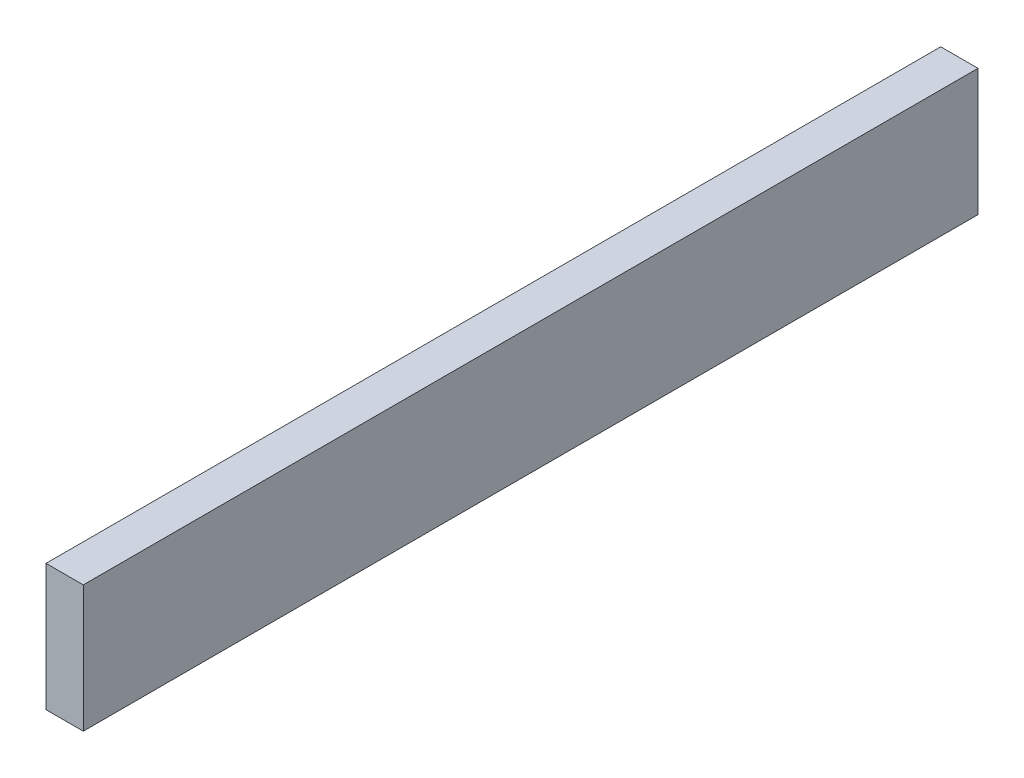
from build123d import *

# Parameters (mm, degrees)
SKIZZE1_W                       = 120
SKIZZE1_H                       = 17
AUFSATZ_LINEAR_AUSTRAGEN1_DEPTH = 5


with BuildPart() as part:
    # Skizze1 → Aufsatz-Linear austragen1 (new body)
    with BuildSketch(Plane(origin=(0, 0, 0), x_dir=(0, 0, -1), z_dir=(1, 0, 0))):
        with Locations((60, 8.5)):
            Rectangle(SKIZZE1_W, SKIZZE1_H)
    extrude(amount=AUFSATZ_LINEAR_AUSTRAGEN1_DEPTH)


solid = part.part
